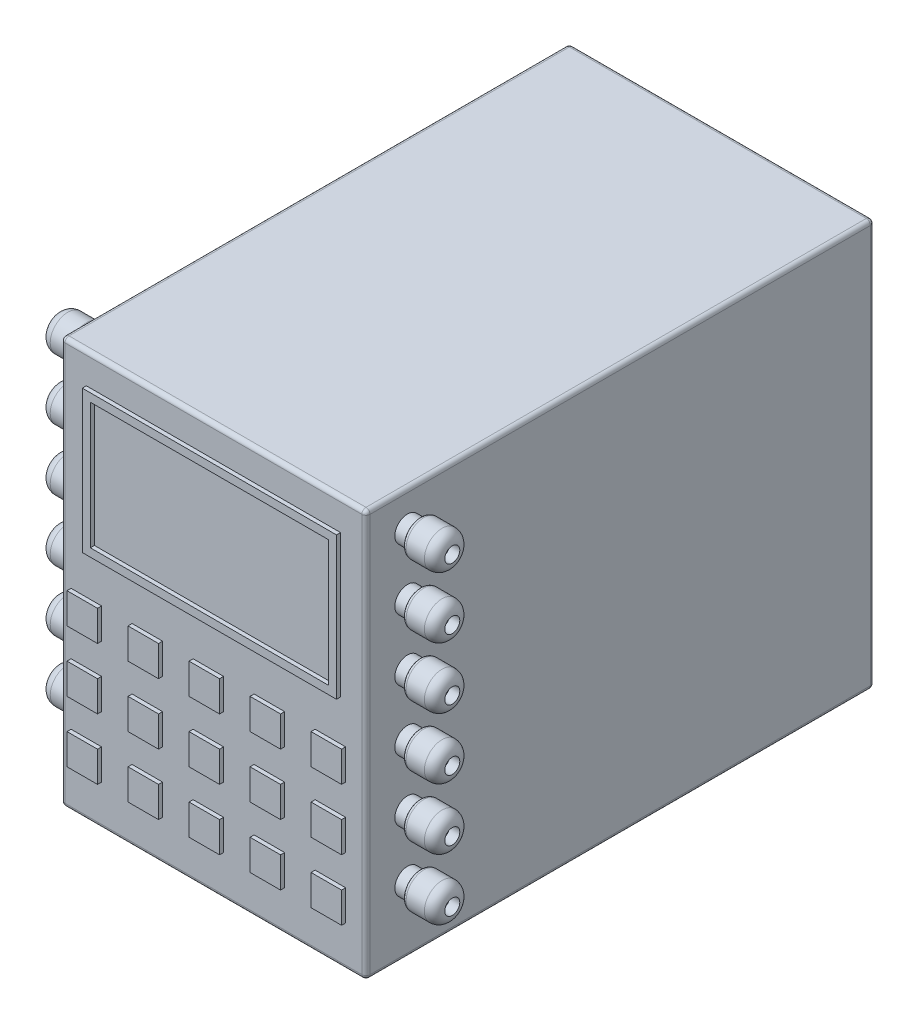
from build123d import *

# Parameters (mm, degrees)
SZKIC1_W                    = 150
SZKIC1_H                    = 250
DODANIE_WYCI_GNI_CIE1_DEPTH = 200
SKORUPA1_T                  = 5
WYTNIJ_WYCI_GNI_CIE1_DEPTH  = 120
SZYK_LINIOWY1_COUNT         = 7
SZYK_LINIOWY1_PITCH         = 20
SZYK_LINIOWY1_COUNT_DIR2    = 3
SZYK_LINIOWY1_PITCH_DIR2    = 60
SZKIC3_W                    = 125
SZKIC3_H                    = 70
SZKIC3_W_2                  = 117
SZKIC3_H_2                  = 62
SZKIC3_W_3                  = 15
SZKIC3_H_3                  = 15
DODANIE_WYCI_GNI_CIE2_DEPTH = 2
ZAOKR_GLENIE1_R             = 2
SZKIC4_R                    = 8.693922927
DODANIE_WYCI_GNI_CIE3_DEPTH = 22
ZAOKR_GLENIE2_R             = 5
SZKIC5_R                    = 8.693922927
SZKIC5_R_2                  = 6.25
WYTNIJ_WYCI_GNI_CIE2_DEPTH  = 6
ZAOKR_GLENIE3_R             = 2
SZKIC6_R                    = 3.693922927
WYTNIJ_WYCI_GNI_CIE3_DEPTH  = 5


# Read off the part's stored shape, not the designer's step: Lustro1
with BuildPart() as part:
    # Szkic1 → Dodanie-wyciągnięcie1 (new body)
    with BuildSketch(Plane(origin=(0, 0, 0), x_dir=(1, 0, 0), z_dir=(0, 1, 0))):
        Rectangle(SZKIC1_W, SZKIC1_H)
    extrude(amount=DODANIE_WYCI_GNI_CIE1_DEPTH)

    # Skorupa1 (no face opened: a closed hollow body)
    add(offset(amount=-SKORUPA1_T, mode=Mode.PRIVATE), mode=Mode.SUBTRACT)

    # Szkic2 → Wytnij-wyciągnięcie1 (cut)
    with BuildSketch(Plane(origin=(0, 0, -125), x_dir=(-1, 0, 0), z_dir=(0, 0, -1))):
        with BuildLine():
            Line((-52.5, 185), (-52.5, 160))
            ThreePointArc((-52.5, 160), (-60, 152.5), (-67.5, 160))
            Line((-67.5, 160), (-67.5, 185))
            ThreePointArc((-67.5, 185), (-60, 192.5), (-52.5, 185))
        make_face()
    wytnij_wyci_gni_cie1 = extrude(amount=-WYTNIJ_WYCI_GNI_CIE1_DEPTH, mode=Mode.SUBTRACT)

    # Szyk liniowy1: Wytnij-wyci_gni_cie1 7 × 3
    with Locations(*[(-i * SZYK_LINIOWY1_PITCH, -j * SZYK_LINIOWY1_PITCH_DIR2, 0) for i in range(SZYK_LINIOWY1_COUNT) for j in range(SZYK_LINIOWY1_COUNT_DIR2) if (i, j) != (0, 0)]):
        add(wytnij_wyci_gni_cie1, mode=Mode.SUBTRACT)

    # Szkic3 → Dodanie-wyciągnięcie2 (add)
    # profile 1 of 16: a face of its own
    with BuildSketch(Plane.XY.offset(125)):
        with Locations((0, 150)):
            Rectangle(SZKIC3_W, SZKIC3_H)
        with Locations((0, 150)):
            Rectangle(SZKIC3_W_2, SZKIC3_H_2, mode=Mode.SUBTRACT)
    # profile 2 of 16: a face of its own
    with BuildSketch(Plane.XY.offset(125)):
        with Locations((-62.5, 87.5)):
            Rectangle(SZKIC3_W_3, SZKIC3_H_3)
    # profile 3 of 16: a face of its own
    with BuildSketch(Plane.XY.offset(125)):
        with Locations((-32.5, 87.5)):
            Rectangle(SZKIC3_W_3, SZKIC3_H_3)
    # profile 4 of 16: a face of its own
    with BuildSketch(Plane.XY.offset(125)):
        with Locations((-2.5, 87.5)):
            Rectangle(SZKIC3_W_3, SZKIC3_H_3)
    # profile 5 of 16: a face of its own
    with BuildSketch(Plane.XY.offset(125)):
        with Locations((27.5, 87.5)):
            Rectangle(SZKIC3_W_3, SZKIC3_H_3)
    # profile 6 of 16: a face of its own
    with BuildSketch(Plane.XY.offset(125)):
        with Locations((57.5, 87.5)):
            Rectangle(SZKIC3_W_3, SZKIC3_H_3)
    # profile 7 of 16: a face of its own
    with BuildSketch(Plane.XY.offset(125)):
        with Locations((-32.5, 57.5)):
            Rectangle(SZKIC3_W_3, SZKIC3_H_3)
    # profile 8 of 16: a face of its own
    with BuildSketch(Plane.XY.offset(125)):
        with Locations((-2.5, 57.5)):
            Rectangle(SZKIC3_W_3, SZKIC3_H_3)
    # profile 9 of 16: a face of its own
    with BuildSketch(Plane.XY.offset(125)):
        with Locations((27.5, 57.5)):
            Rectangle(SZKIC3_W_3, SZKIC3_H_3)
    # profile 10 of 16: a face of its own
    with BuildSketch(Plane.XY.offset(125)):
        with Locations((57.5, 57.5)):
            Rectangle(SZKIC3_W_3, SZKIC3_H_3)
    # profile 11 of 16: a face of its own
    with BuildSketch(Plane.XY.offset(125)):
        with Locations((-32.5, 27.5)):
            Rectangle(SZKIC3_W_3, SZKIC3_H_3)
    # profile 12 of 16: a face of its own
    with BuildSketch(Plane.XY.offset(125)):
        with Locations((-2.5, 27.5)):
            Rectangle(SZKIC3_W_3, SZKIC3_H_3)
    # profile 13 of 16: a face of its own
    with BuildSketch(Plane.XY.offset(125)):
        with Locations((27.5, 27.5)):
            Rectangle(SZKIC3_W_3, SZKIC3_H_3)
    # profile 14 of 16: a face of its own
    with BuildSketch(Plane.XY.offset(125)):
        with Locations((57.5, 27.5)):
            Rectangle(SZKIC3_W_3, SZKIC3_H_3)
    # profile 15 of 16: a face of its own
    with BuildSketch(Plane.XY.offset(125)):
        with Locations((-62.5, 57.5)):
            Rectangle(SZKIC3_W_3, SZKIC3_H_3)
    # profile 16 of 16: a face of its own
    with BuildSketch(Plane.XY.offset(125)):
        with Locations((-62.5, 27.5)):
            Rectangle(SZKIC3_W_3, SZKIC3_H_3)
    extrude(amount=DODANIE_WYCI_GNI_CIE2_DEPTH)

    # Zaokrąglenie1
    zaokr_glenie1_edges = [part.edges().sort_by_distance(p)[0] for p in [
        (-75, 200, 0),
        (40, 132.5, -125),
        (32.5, 112.5, -125),
        (40, 92.5, -125),
        (47.5, 112.5, -125),
        (20, 132.5, -125),
        (12.5, 112.5, -125),
        (20, 92.5, -125),
        (27.5, 112.5, -125),
        (0, 132.5, -125),
        (-7.5, 112.5, -125),
        (0, 92.5, -125),
        (7.5, 112.5, -125),
        (-20, 132.5, -125),
        (-27.5, 112.5, -125),
        (-20, 92.5, -125),
        (0, 200, 125),
        (-12.5, 112.5, -125),
        (-40, 132.5, -125),
        (-47.5, 112.5, -125),
        (-40, 92.5, -125),
        (-32.5, 112.5, -125),
        (-60, 132.5, -125),
        (-67.5, 112.5, -125),
        (-60, 92.5, -125),
        (-52.5, 112.5, -125),
        (60, 72.5, -125),
        (52.5, 52.5, -125),
        (60, 32.5, -125),
        (67.5, 52.5, -125),
        (40, 72.5, -125),
        (32.5, 52.5, -125),
        (40, 32.5, -125),
        (47.5, 52.5, -125),
        (20, 72.5, -125),
        (12.5, 52.5, -125),
        (20, 32.5, -125),
        (27.5, 52.5, -125),
        (0, 72.5, -125),
        (-7.5, 52.5, -125),
        (0, 32.5, -125),
        (7.5, 52.5, -125),
        (-20, 72.5, -125),
        (-27.5, 52.5, -125),
        (-20, 32.5, -125),
        (-12.5, 52.5, -125),
        (-40, 72.5, -125),
        (-47.5, 52.5, -125),
        (-40, 32.5, -125),
        (-32.5, 52.5, -125),
        (-60, 72.5, -125),
        (-67.5, 52.5, -125),
        (-60, 32.5, -125),
        (-52.5, 52.5, -125),
        (60, 192.5, -125),
        (67.5, 172.5, -125),
        (60, 152.5, -125),
        (52.5, 172.5, -125),
        (75, 200, 0),
        (0, 0, 125),
        (40, 192.5, -125),
        (47.5, 172.5, -125),
        (40, 152.5, -125),
        (-75, 0, 0),
        (32.5, 172.5, -125),
        (0, 0, -125),
        (75, 0, 0),
        (20, 192.5, -125),
        (12.5, 172.5, -125),
        (20, 152.5, -125),
        (27.5, 172.5, -125),
        (0, 192.5, -125),
        (-7.5, 172.5, -125),
        (0, 152.5, -125),
        (7.5, 172.5, -125),
        (0, 200, -125),
        (-20, 192.5, -125),
        (75, 100, 125),
        (-27.5, 172.5, -125),
        (-20, 152.5, -125),
        (-12.5, 172.5, -125),
        (-75, 100, 125),
        (-75, 100, -125),
        (75, 100, -125),
        (-40, 192.5, -125),
        (-47.5, 172.5, -125),
        (-40, 152.5, -125),
        (-32.5, 172.5, -125),
        (-60, 192.5, -125),
        (-67.5, 172.5, -125),
        (-60, 152.5, -125),
        (-52.5, 172.5, -125),
        (60, 132.5, -125),
        (52.5, 112.5, -125),
        (60, 92.5, -125),
        (67.5, 112.5, -125),
    ]]
    fillet(zaokr_glenie1_edges, radius=ZAOKR_GLENIE1_R)

    # Szkic4 → Dodanie-wyciągnięcie3 (add)
    with BuildSketch(Plane(origin=(75, 0, 0), x_dir=(0, 0, -1), z_dir=(1, 0, 0))):
        with Locations(Location((-104.561536965, 182.675314581, 0), (0, 0, 180))):
            Circle(SZKIC4_R)
        with Locations(Location((-104.561536965, 152.675314581, 0), (0, 0, 180))):
            Circle(SZKIC4_R)
        with Locations(Location((-104.561536965, 122.675314581, 0), (0, 0, 180))):
            Circle(SZKIC4_R)
        with Locations(Location((-104.561536965, 92.675314581, 0), (0, 0, 180))):
            Circle(SZKIC4_R)
        with Locations(Location((-104.561536965, 62.675314581, 0), (0, 0, 180))):
            Circle(SZKIC4_R)
        with Locations(Location((-104.561536965, 32.675314581, 0), (0, 0, 180))):
            Circle(SZKIC4_R)
    extrude(amount=DODANIE_WYCI_GNI_CIE3_DEPTH)

    # Zaokrąglenie2
    zaokr_glenie2_edges = [part.edges().sort_by_distance(p)[0] for p in [
        (97, 182.675314581, 95.867614038),
        (97, 152.675314581, 95.867614038),
        (97, 122.675314581, 95.867614038),
        (97, 92.675314581, 95.867614038),
        (97, 62.675314581, 95.867614038),
        (97, 32.675314581, 95.867614038),
    ]]
    fillet(zaokr_glenie2_edges, radius=ZAOKR_GLENIE2_R)

    # Szkic5 → Wytnij-wyciągnięcie2 (cut)
    # profile 1 of 6: a face of its own
    with BuildSketch(Plane(origin=(75, 0, 0), x_dir=(0, 0, -1), z_dir=(1, 0, 0))):
        with Locations((-104.561536965, 182.675314581)):
            Circle(SZKIC5_R)
        with Locations((-104.561536965, 182.675314581)):
            Circle(SZKIC5_R_2, mode=Mode.SUBTRACT)
    # profile 2 of 6: a face of its own
    with BuildSketch(Plane(origin=(75, 0, 0), x_dir=(0, 0, -1), z_dir=(1, 0, 0))):
        with Locations((-104.561536965, 152.675314581)):
            Circle(SZKIC5_R)
        with Locations((-104.561536965, 152.675314581)):
            Circle(SZKIC5_R_2, mode=Mode.SUBTRACT)
    # profile 3 of 6: a face of its own
    with BuildSketch(Plane(origin=(75, 0, 0), x_dir=(0, 0, -1), z_dir=(1, 0, 0))):
        with Locations((-104.561536965, 122.675314581)):
            Circle(SZKIC5_R)
        with Locations((-104.561536965, 122.675314581)):
            Circle(SZKIC5_R_2, mode=Mode.SUBTRACT)
    # profile 4 of 6: a face of its own
    with BuildSketch(Plane(origin=(75, 0, 0), x_dir=(0, 0, -1), z_dir=(1, 0, 0))):
        with Locations((-104.561536965, 92.675314581)):
            Circle(SZKIC5_R)
        with Locations((-104.561536965, 92.675314581)):
            Circle(SZKIC5_R_2, mode=Mode.SUBTRACT)
    # profile 5 of 6: a face of its own
    with BuildSketch(Plane(origin=(75, 0, 0), x_dir=(0, 0, -1), z_dir=(1, 0, 0))):
        with Locations((-104.561536965, 62.675314581)):
            Circle(SZKIC5_R)
        with Locations((-104.561536965, 62.675314581)):
            Circle(SZKIC5_R_2, mode=Mode.SUBTRACT)
    # profile 6 of 6: a face of its own
    with BuildSketch(Plane(origin=(75, 0, 0), x_dir=(0, 0, -1), z_dir=(1, 0, 0))):
        with Locations((-104.561536965, 32.675314581)):
            Circle(SZKIC5_R)
        with Locations((-104.561536965, 32.675314581)):
            Circle(SZKIC5_R_2, mode=Mode.SUBTRACT)
    extrude(amount=WYTNIJ_WYCI_GNI_CIE2_DEPTH, mode=Mode.SUBTRACT)

    # Zaokrąglenie3
    zaokr_glenie3_edges = [part.edges().sort_by_distance(p)[0] for p in [
        (81, 182.675314581, 95.867614038),
        (81, 152.675314581, 95.867614038),
        (81, 122.675314581, 95.867614038),
        (81, 92.675314581, 95.867614038),
        (81, 62.675314581, 95.867614038),
        (81, 32.675314581, 95.867614038),
    ]]
    fillet(zaokr_glenie3_edges, radius=ZAOKR_GLENIE3_R)

    # Szkic6 → Wytnij-wyciągnięcie3 (cut)
    with BuildSketch(Plane(origin=(97, 0, 0), x_dir=(0, 0, -1), z_dir=(1, 0, 0))):
        with Locations((-104.561536965, 182.675314581)):
            Circle(SZKIC6_R)
        with Locations((-104.561536965, 152.675314581)):
            Circle(SZKIC6_R)
        with Locations((-104.561536965, 122.675314581)):
            Circle(SZKIC6_R)
        with Locations((-104.561536965, 92.675314581)):
            Circle(SZKIC6_R)
        with Locations((-104.561536965, 62.675314581)):
            Circle(SZKIC6_R)
        with Locations((-104.561536965, 32.675314581)):
            Circle(SZKIC6_R)
    extrude(amount=-WYTNIJ_WYCI_GNI_CIE3_DEPTH, mode=Mode.SUBTRACT)

    # Lustro1 outline → Lustro1 (revolve)
    with BuildSketch(Plane(origin=(0, 182.675314581, 104.561536965), x_dir=(0, 1, 0), z_dir=(0, 0, -1))):
        with BuildLine():
            Line((6.25, -75), (0, -75))
            Line((0, -75), (0, -92))
            Line((0, -92), (3.693922927, -92))
            Line((3.693922927, -92), (3.693922927, -97))
            ThreePointArc((3.693922927, -97), (7.229456833, -95.535533906), (8.693922927, -92))
            Line((8.693922927, -92), (8.693922927, -83))
            ThreePointArc((8.693922927, -83), (8.108136489, -81.585786438), (6.693922927, -81))
            Line((6.693922927, -81), (6.25, -81))
            Line((6.25, -81), (6.25, -75))
        make_face()
    revolve(axis=Axis((0, 182.675314581, 104.561536965), (1, 0, 0)))

    # Lustro1 2 outline → Lustro1 2 (revolve)
    with BuildSketch(Plane(origin=(0, 32.675314581, 104.561536965), x_dir=(0, 1, 0), z_dir=(0, 0, -1))):
        with BuildLine():
            Line((6.25, -75), (0, -75))
            Line((0, -75), (0, -92))
            Line((0, -92), (3.693922927, -92))
            Line((3.693922927, -92), (3.693922927, -97))
            ThreePointArc((3.693922927, -97), (7.229456833, -95.535533906), (8.693922927, -92))
            Line((8.693922927, -92), (8.693922927, -83))
            ThreePointArc((8.693922927, -83), (8.108136489, -81.585786438), (6.693922927, -81))
            Line((6.693922927, -81), (6.25, -81))
            Line((6.25, -81), (6.25, -75))
        make_face()
    revolve(axis=Axis((0, 32.675314581, 104.561536965), (1, 0, 0)))

    # Lustro1 3 outline → Lustro1 3 (revolve)
    with BuildSketch(Plane(origin=(0, 62.675314581, 104.561536965), x_dir=(0, 1, 0), z_dir=(0, 0, -1))):
        with BuildLine():
            Line((6.25, -75), (0, -75))
            Line((0, -75), (0, -92))
            Line((0, -92), (3.693922927, -92))
            Line((3.693922927, -92), (3.693922927, -97))
            ThreePointArc((3.693922927, -97), (7.229456833, -95.535533906), (8.693922927, -92))
            Line((8.693922927, -92), (8.693922927, -83))
            ThreePointArc((8.693922927, -83), (8.108136489, -81.585786438), (6.693922927, -81))
            Line((6.693922927, -81), (6.25, -81))
            Line((6.25, -81), (6.25, -75))
        make_face()
    revolve(axis=Axis((0, 62.675314581, 104.561536965), (1, 0, 0)))

    # Lustro1 4 outline → Lustro1 4 (revolve)
    with BuildSketch(Plane(origin=(0, 92.675314581, 104.561536965), x_dir=(0, 1, 0), z_dir=(0, 0, -1))):
        with BuildLine():
            Line((6.25, -75), (0, -75))
            Line((0, -75), (0, -92))
            Line((0, -92), (3.693922927, -92))
            Line((3.693922927, -92), (3.693922927, -97))
            ThreePointArc((3.693922927, -97), (7.229456833, -95.535533906), (8.693922927, -92))
            Line((8.693922927, -92), (8.693922927, -83))
            ThreePointArc((8.693922927, -83), (8.108136489, -81.585786438), (6.693922927, -81))
            Line((6.693922927, -81), (6.25, -81))
            Line((6.25, -81), (6.25, -75))
        make_face()
    revolve(axis=Axis((0, 92.675314581, 104.561536965), (1, 0, 0)))

    # Lustro1 5 outline → Lustro1 5 (revolve)
    with BuildSketch(Plane(origin=(0, 122.675314581, 104.561536965), x_dir=(0, 1, 0), z_dir=(0, 0, -1))):
        with BuildLine():
            Line((6.25, -75), (0, -75))
            Line((0, -75), (0, -92))
            Line((0, -92), (3.693922927, -92))
            Line((3.693922927, -92), (3.693922927, -97))
            ThreePointArc((3.693922927, -97), (7.229456833, -95.535533906), (8.693922927, -92))
            Line((8.693922927, -92), (8.693922927, -83))
            ThreePointArc((8.693922927, -83), (8.108136489, -81.585786438), (6.693922927, -81))
            Line((6.693922927, -81), (6.25, -81))
            Line((6.25, -81), (6.25, -75))
        make_face()
    revolve(axis=Axis((0, 122.675314581, 104.561536965), (1, 0, 0)))

    # Lustro1 6 outline → Lustro1 6 (revolve)
    with BuildSketch(Plane(origin=(0, 152.675314581, 104.561536965), x_dir=(0, 1, 0), z_dir=(0, 0, -1))):
        with BuildLine():
            Line((6.25, -75), (0, -75))
            Line((0, -75), (0, -92))
            Line((0, -92), (3.693922927, -92))
            Line((3.693922927, -92), (3.693922927, -97))
            ThreePointArc((3.693922927, -97), (7.229456833, -95.535533906), (8.693922927, -92))
            Line((8.693922927, -92), (8.693922927, -83))
            ThreePointArc((8.693922927, -83), (8.108136489, -81.585786438), (6.693922927, -81))
            Line((6.693922927, -81), (6.25, -81))
            Line((6.25, -81), (6.25, -75))
        make_face()
    revolve(axis=Axis((0, 152.675314581, 104.561536965), (1, 0, 0)))


solid = part.part
